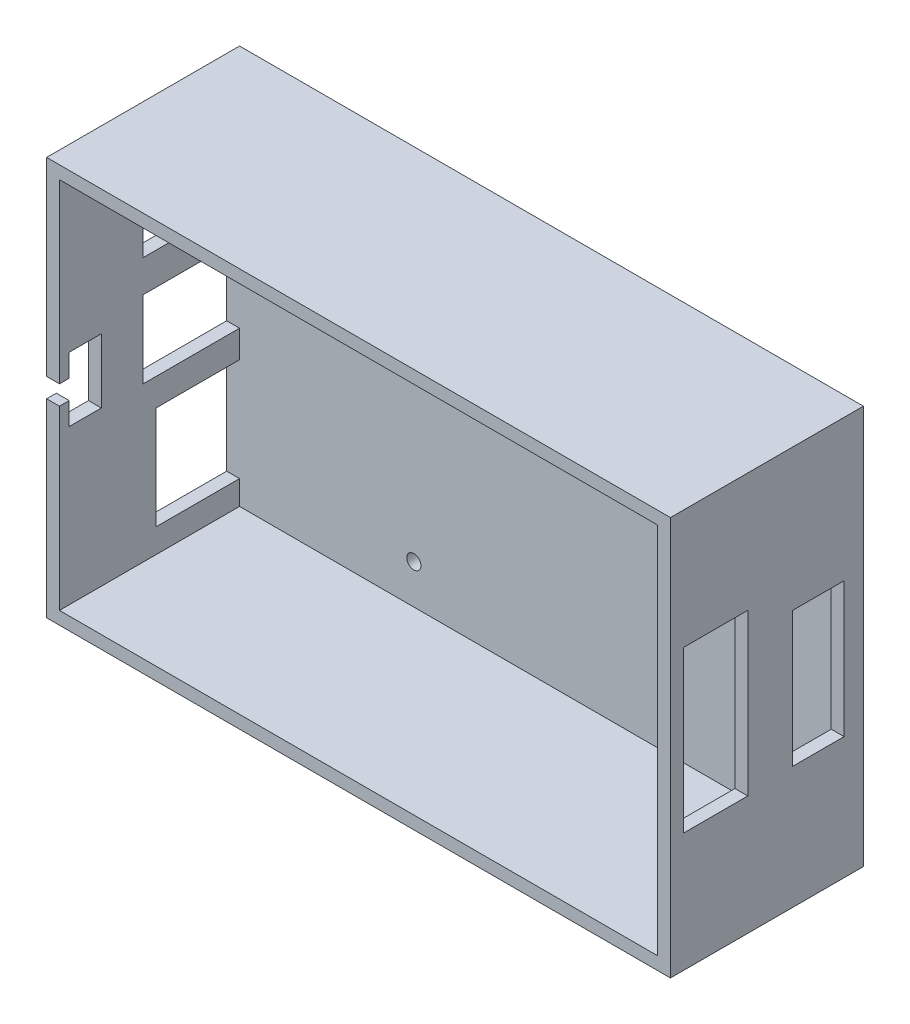
from build123d import *

# Parameters (mm, degrees)
ESQUISSE1_W              = 93
ESQUISSE1_H              = 58
BOSS_EXTRU_1_DEPTH       = 2
ESQUISSE3_W              = 30
ESQUISSE3_H              = 58
BOSS_EXTRU_2_DEPTH       = 2
ESQUISSE4_W              = 95
ESQUISSE4_H              = 30
BOSS_EXTRU_3_DEPTH       = 2
ESQUISSE5_W              = 8
ESQUISSE5_H              = 21
ENL_V_MAT_EXTRU_1_DEPTH  = 2
ESQUISSE6_W              = 30
ESQUISSE6_H              = 60
BOSS_EXTRU_4_DEPTH       = 2
ESQUISSE11_W             = 15
ESQUISSE11_H             = 12
ENL_V_MAT_EXTRU_7_DEPTH  = 10
ESQUISSE12_W             = 15
ESQUISSE12_H             = 12
ENL_V_MAT_EXTRU_8_DEPTH  = 10
ESQUISSE13_W             = 13
ESQUISSE13_H             = 16
ENL_V_MAT_EXTRU_9_DEPTH  = 10
ESQUISSE14_W             = 97
ESQUISSE14_H             = 30
BOSS_EXTRU_6_DEPTH       = 2
ESQUISSE15_W             = 10
ESQUISSE15_H             = 25
ENL_V_MAT_EXTRU_10_DEPTH = 2
ESQUISSE17_W             = 8
ESQUISSE17_H             = 5
ENL_V_MAT_EXTRU_11_DEPTH = 2
ESQUISSE18_W             = 5
ESQUISSE18_H             = 10
ENL_V_MAT_EXTRU_12_DEPTH = 2
ESQUISSE19_R             = 1.1
ENL_V_MAT_EXTRU_13_DEPTH = 2
ESQUISSE20_R             = 1.1
ENL_V_MAT_EXTRU_14_DEPTH = 2
ESQUISSE21_R             = 1.1
ENL_V_MAT_EXTRU_15_DEPTH = 2
ESQUISSE22_R             = 1.1
ENL_V_MAT_EXTRU_16_DEPTH = 2
ESQUISSE23_W             = 1.512045333
ESQUISSE23_H             = 3
ENL_V_MAT_EXTRU_17_DEPTH = 10


with BuildPart() as part:
    # Esquisse1 → Boss.-Extru.1 (new body)
    with BuildSketch(Plane.XY):
        with Locations((16.450898184, 5.574307305)):
            Rectangle(ESQUISSE1_W, ESQUISSE1_H)
    extrude(amount=BOSS_EXTRU_1_DEPTH)

    # Esquisse3 → Boss.-Extru.2 (add)
    with BuildSketch(Plane(origin=(62.950898184, 0, 0), x_dir=(0, 0, -1), z_dir=(1, 0, 0))):
        with Locations((-15, 5.574307305)):
            Rectangle(ESQUISSE3_W, ESQUISSE3_H)
    extrude(amount=BOSS_EXTRU_2_DEPTH)

    # Esquisse4 → Boss.-Extru.3 (add)
    with BuildSketch(Plane.XZ.offset(23.425692695)):
        with Locations((17.450898184, 15)):
            Rectangle(ESQUISSE4_W, ESQUISSE4_H)
    extrude(amount=BOSS_EXTRU_3_DEPTH)

    # Esquisse5 → Enlèv. mat.-Extru.1 (cut)
    with BuildSketch(Plane(origin=(64.950898184, 0, 0), x_dir=(0, 0, -1), z_dir=(1, 0, 0))):
        with Locations((-7, 4.074307305)):
            Rectangle(ESQUISSE5_W, ESQUISSE5_H)
    extrude(amount=-ENL_V_MAT_EXTRU_1_DEPTH, mode=Mode.SUBTRACT)

    # Esquisse6 → Boss.-Extru.4 (add)
    with BuildSketch(Plane.ZY.offset(30.049101816)):
        with Locations((15, 4.574307305)):
            Rectangle(ESQUISSE6_W, ESQUISSE6_H)
    extrude(amount=BOSS_EXTRU_4_DEPTH)

    # Esquisse11 → Enlèv. mat.-Extru.7 (cut)
    with BuildSketch(Plane.ZY.offset(32.049101816)):
        with Locations((9.5, 23.574307305)):
            Rectangle(ESQUISSE11_W, ESQUISSE11_H)
    extrude(amount=-ENL_V_MAT_EXTRU_7_DEPTH, mode=Mode.SUBTRACT)

    # Esquisse12 → Enlèv. mat.-Extru.8 (cut)
    with BuildSketch(Plane.ZY.offset(32.049101816)):
        with Locations((9.5, 6.574307305)):
            Rectangle(ESQUISSE12_W, ESQUISSE12_H)
    extrude(amount=-ENL_V_MAT_EXTRU_8_DEPTH, mode=Mode.SUBTRACT)

    # Esquisse13 → Enlèv. mat.-Extru.9 (cut)
    with BuildSketch(Plane.ZY.offset(32.049101816)):
        with Locations((8.5, -11.675692695)):
            Rectangle(ESQUISSE13_W, ESQUISSE13_H)
    extrude(amount=-ENL_V_MAT_EXTRU_9_DEPTH, mode=Mode.SUBTRACT)

    # Esquisse14 → Boss.-Extru.6 (add)
    with BuildSketch(Plane(origin=(0, 34.574307305, 0), x_dir=(1, 0, 0), z_dir=(0, 1, 0))):
        with Locations((16.450898184, -15)):
            Rectangle(ESQUISSE14_W, ESQUISSE14_H)
    extrude(amount=BOSS_EXTRU_6_DEPTH)

    # Esquisse15 → Enlèv. mat.-Extru.10 (cut)
    with BuildSketch(Plane(origin=(64.950898184, 0, 0), x_dir=(0, 0, -1), z_dir=(1, 0, 0))):
        with Locations((-22.966777096, 5.574307305)):
            Rectangle(ESQUISSE15_W, ESQUISSE15_H)
    extrude(amount=-ENL_V_MAT_EXTRU_10_DEPTH, mode=Mode.SUBTRACT)

    # Esquisse17 → Enlèv. mat.-Extru.11 (cut)
    with BuildSketch(Plane.XZ.offset(25.425692695)):
        with Locations((51.950898184, 3.907690412)):
            Rectangle(ESQUISSE17_W, ESQUISSE17_H)
    extrude(amount=-ENL_V_MAT_EXTRU_11_DEPTH, mode=Mode.SUBTRACT)

    # Esquisse18 → Enlèv. mat.-Extru.12 (cut)
    with BuildSketch(Plane.ZY.offset(32.049101816)):
        with Locations((25.987954667, 5.574307305)):
            Rectangle(ESQUISSE18_W, ESQUISSE18_H)
    extrude(amount=-ENL_V_MAT_EXTRU_12_DEPTH, mode=Mode.SUBTRACT)

    # Esquisse19 → Enlèv. mat.-Extru.13 (cut)
    with BuildSketch(Plane.XY.offset(2)):
        with Locations((56.850898184, 30.474307305)):
            Circle(ESQUISSE19_R)
    extrude(amount=-ENL_V_MAT_EXTRU_13_DEPTH, mode=Mode.SUBTRACT)

    # Esquisse20 → Enlèv. mat.-Extru.14 (cut)
    with BuildSketch(Plane.XY.offset(2)):
        with Locations((56.850898184, -19.325692695)):
            Circle(ESQUISSE20_R)
    extrude(amount=-ENL_V_MAT_EXTRU_14_DEPTH, mode=Mode.SUBTRACT)

    # Esquisse21 → Enlèv. mat.-Extru.15 (cut)
    with BuildSketch(Plane.XY.offset(2)):
        with Locations((-2.949101816, 28.474307305)):
            Circle(ESQUISSE21_R)
    extrude(amount=-ENL_V_MAT_EXTRU_15_DEPTH, mode=Mode.SUBTRACT)

    # Esquisse22 → Enlèv. mat.-Extru.16 (cut)
    with BuildSketch(Plane.XY.offset(2)):
        with Locations((-2.949101816, -17.325692695)):
            Circle(ESQUISSE22_R)
    extrude(amount=-ENL_V_MAT_EXTRU_16_DEPTH, mode=Mode.SUBTRACT)

    # Esquisse23 → Enlèv. mat.-Extru.17 (cut)
    with BuildSketch(Plane.ZY.offset(32.049101816)):
        with Locations((29.243977334, 5.574307305)):
            Rectangle(ESQUISSE23_W, ESQUISSE23_H)
    extrude(amount=-ENL_V_MAT_EXTRU_17_DEPTH, mode=Mode.SUBTRACT)


solid = part.part
